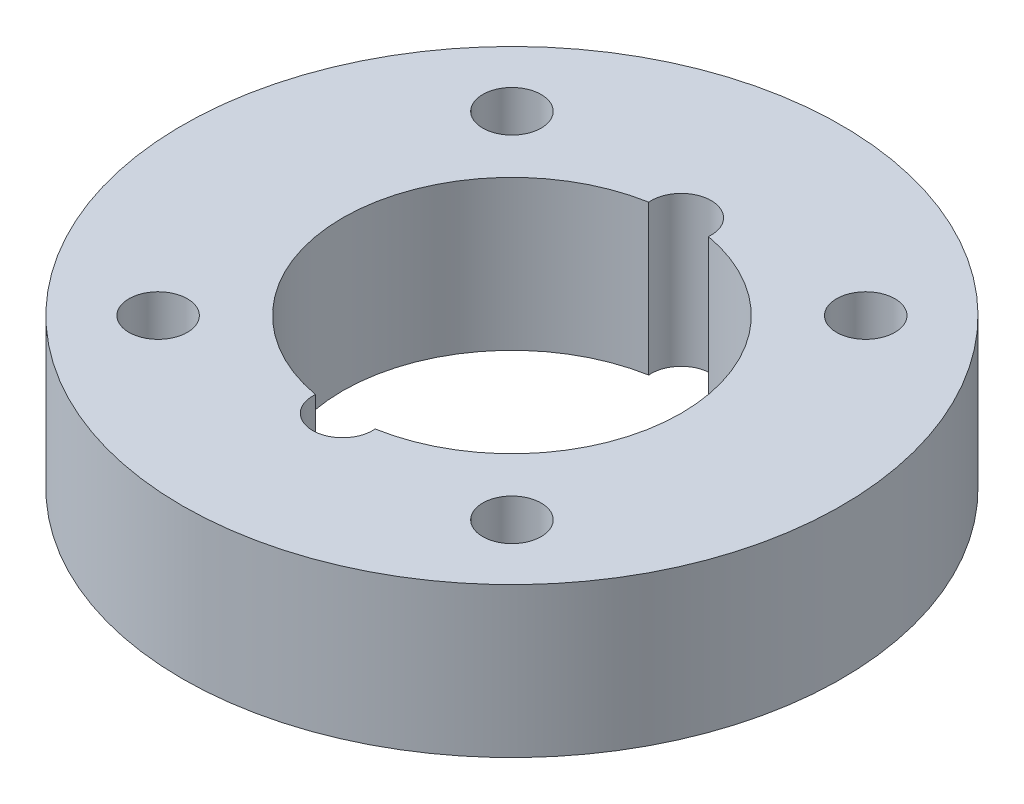
from build123d import *

# Parameters (mm, degrees)
F_0_5IN_SOCKET_R    = 27.94
F_0_5IN_SOCKET_R_2  = 2.475
BOSS_EXTRUDE1_DEPTH = 12.7


with BuildPart() as part:
    # 0.5in Socket → Boss-Extrude1 (new body)
    with BuildSketch(Plane(origin=(0, 0, 0), x_dir=(1, 0, 0), z_dir=(0, 1, 0))):
        Circle(F_0_5IN_SOCKET_R)
        with Locations((-14.997027722, -14.997027722)):
            Circle(F_0_5IN_SOCKET_R_2, mode=Mode.SUBTRACT)
        with Locations((14.997027722, -14.997027722)):
            Circle(F_0_5IN_SOCKET_R_2, mode=Mode.SUBTRACT)
        with BuildLine():
            ThreePointArc((-2.530034488, -14.126221239), (-14.351, 0), (-2.530034488, 14.126221239))
            ThreePointArc((-2.530034488, 14.126221239), (0, 16.891), (2.530034488, 14.126221239))
            ThreePointArc((2.530034488, 14.126221239), (14.351, 0), (2.530034488, -14.126221239))
            ThreePointArc((2.530034488, -14.126221239), (0, -16.891), (-2.530034488, -14.126221239))
        make_face(mode=Mode.SUBTRACT)
        with Locations((-14.997027722, 14.997027722)):
            Circle(F_0_5IN_SOCKET_R_2, mode=Mode.SUBTRACT)
        with Locations((14.997027722, 14.997027722)):
            Circle(F_0_5IN_SOCKET_R_2, mode=Mode.SUBTRACT)
    extrude(amount=BOSS_EXTRUDE1_DEPTH)


solid = part.part
